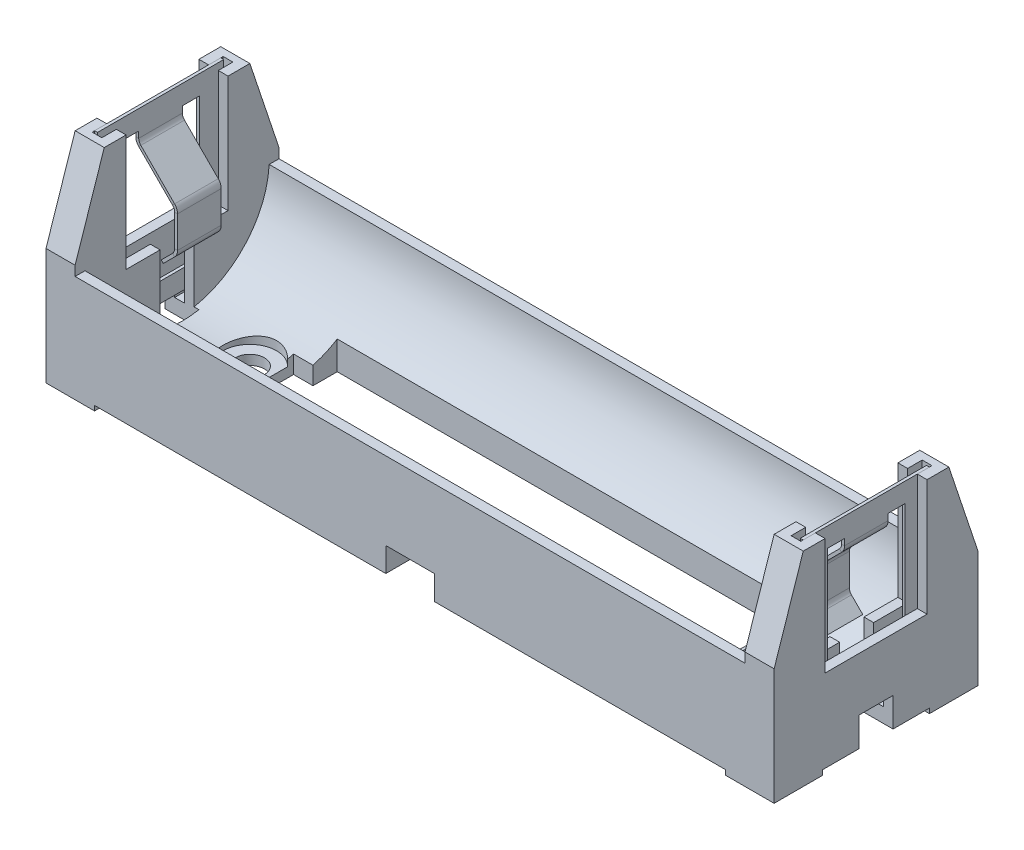
from build123d import *

# Parameters (mm, degrees)
SKETCH1_W              = 75
SKETCH1_H              = 21
BOSS_EXTRUDE1_DEPTH    = 21
CUT_EXTRUDE1_DEPTH     = 0.5
SKETCH5_W              = 2
SKETCH5_H              = 2.5
CUT_EXTRUDE2_DEPTH     = 45.008521902
SKETCH6_W              = 5
SKETCH6_H              = 2.5
CUT_EXTRUDE3_DEPTH     = 2.5
SKETCH8_W              = 34.5
SKETCH8_H              = 10
CUT_EXTRUDE4_DEPTH     = 48.835656157
SKETCH9_W              = 10.5
SKETCH9_H              = 12
CUT_EXTRUDE5_DEPTH     = 79.589121385
CUT_EXTRUDE6_REACH     = 77.731
SKETCH10_R             = 9.5
SKETCH11_W             = 1
SKETCH11_H             = 13.5
CUT_EXTRUDE7_DEPTH     = 19
SKETCH12_W             = 3.5
SKETCH12_H             = 3.5
CUT_EXTRUDE8_DEPTH     = 3
SKETCH13_W             = 1
SKETCH13_H             = 3.5
CUT_EXTRUDE9_DEPTH     = 43.693676347
SKETCH14_R             = 1.5
CUT_EXTRUDE10_DEPTH    = 45.008521902
SKETCH15_R             = 2.75
CUT_EXTRUDE11_DEPTH    = 3
SKETCH16_W             = 13
SKETCH16_H             = 18.5
BASE_FLANGE1_DEPTH     = 0.3
JOG1_START             = -2.25
JOG1_DEPTH             = 4.5
JOG1_2_DEPTH           = 4.5
SKETCHED_START         = -2.25
SKETCHED_BEND1_DEPTH   = 4.5
SKETCHED_BEND1_2_DEPTH = 4.5


# Read off the part's stored shape, not the designer's step: Jog1, Sketched Bend1
# Sheet-metal steps are written as plain solids
with BuildPart() as part:
    # Sketch1 → Boss-Extrude1 (new body)
    with BuildSketch(Plane(origin=(0, 0, 0), x_dir=(1, 0, 0), z_dir=(0, 1, 0))):
        Rectangle(SKETCH1_W, SKETCH1_H)
    extrude(amount=BOSS_EXTRUDE1_DEPTH)

    # Sketch2 → Cut-Extrude1 (cut)
    with BuildSketch(Plane.XZ):
        Polygon((-36, 5.5), (-37.5, 5.5), (-37.5, -5.5), (-36, -5.5), (-36, -9), (-32.5, -9), (-32.5, -10.5), (32.5, -10.5), (32.5, -9), (36, -9), (36, -5.5), (37.5, -5.5), (37.5, 5.5), (36, 5.5), (36, 9), (32.5, 9), (32.5, 10.5), (-32.5, 10.5), (-32.5, 9), (-36, 9), align=None)
    extrude(amount=-CUT_EXTRUDE1_DEPTH, mode=Mode.SUBTRACT)

    # Sketch5 → Cut-Extrude2 (cut, through all)
    with BuildSketch(Plane.XZ.offset(-0.5)):
        Polygon((24, 0), (-23, 0), (-23, -2.5), (-23, -5), (24, -5), align=None)
        Polygon((-23, 2.5), (-23, 0), (24, 0), (24, 5), (-23, 5), align=None)
        with Locations((-24, 1.25)):
            Rectangle(SKETCH5_W, SKETCH5_H)
        with Locations((-24, -1.25)):
            Rectangle(SKETCH5_W, SKETCH5_H)
    extrude(amount=-CUT_EXTRUDE2_DEPTH, mode=Mode.SUBTRACT)

    # Sketch6 → Cut-Extrude3 (cut)
    with BuildSketch(Plane.XZ.offset(-0.5)):
        with Locations((0, -9.25)):
            Rectangle(SKETCH6_W, SKETCH6_H)
        with Locations((0, 9.25)):
            Rectangle(SKETCH6_W, SKETCH6_H)
    extrude(amount=-CUT_EXTRUDE3_DEPTH, mode=Mode.SUBTRACT)

    # Sketch8 → Cut-Extrude4 (cut, through all)
    with BuildSketch(Plane.XY.offset(10.5)):
        with Locations((-17.25, 16)):
            Rectangle(SKETCH8_W, SKETCH8_H)
        with Locations((17.25, 16)):
            Rectangle(SKETCH8_W, SKETCH8_H)
    extrude(amount=-CUT_EXTRUDE4_DEPTH, mode=Mode.SUBTRACT)

    # Sketch9 → Cut-Extrude5 (cut, through all)
    with BuildSketch(Plane(origin=(37.5, 0, 0), x_dir=(0, 0, -1), z_dir=(1, 0, 0))):
        with Locations((0, 15)):
            Rectangle(SKETCH9_W, SKETCH9_H)
        Polygon((-7.5, 21), (-10.5, 12), (-10.5, 21), align=None)
        Polygon((7.5, 21), (10.5, 12), (10.5, 21), align=None)
    extrude(amount=-CUT_EXTRUDE5_DEPTH, mode=Mode.SUBTRACT)

    # Cut-Extrude6: up to this face of the body (flat: up to its plane)
    cut_extrude6_end = Plane(part.part.faces().sort_by_distance((34.5, 15.307692308, 7.3125))[0])
    # Sketch10 → Cut-Extrude6 (cut, up to the picked face)
    with BuildSketch(Plane(origin=(-34.5, 0, 0), x_dir=(0, 0, -1), z_dir=(1, 0, 0)), mode=Mode.PRIVATE) as cut_extrude6_sk1:
        with Locations((0, 11.5)):
            Circle(SKETCH10_R)
    cut_extrude6_tool1 = split(extrude(cut_extrude6_sk1.sketch, amount=CUT_EXTRUDE6_REACH, mode=Mode.PRIVATE), bisect_by=cut_extrude6_end, keep=Keep.BOTH, mode=Mode.PRIVATE)
    add(cut_extrude6_tool1.solids().sort_by(Axis((-34.5, 11.5, 0), (1, 0, 0)))[0], mode=Mode.SUBTRACT)

    # Sketch11 → Cut-Extrude7 (cut)
    with BuildSketch(Plane(origin=(0, 21, 0), x_dir=(1, 0, 0), z_dir=(0, 1, 0))):
        with Locations((-36, 0)):
            Rectangle(SKETCH11_W, SKETCH11_H)
        with Locations((36, 0)):
            Rectangle(SKETCH11_W, SKETCH11_H)
    extrude(amount=-CUT_EXTRUDE7_DEPTH, mode=Mode.SUBTRACT)

    # Sketch12 → Cut-Extrude8 (cut)
    with BuildSketch(Plane.XZ.offset(-0.5)):
        with Locations((35.75, 0)):
            Rectangle(SKETCH12_W, SKETCH12_H)
        with Locations((-35.75, 0)):
            Rectangle(SKETCH12_W, SKETCH12_H)
    extrude(amount=-CUT_EXTRUDE8_DEPTH, mode=Mode.SUBTRACT)

    # Sketch13 → Cut-Extrude9 (cut, through all)
    with BuildSketch(Plane.XZ.offset(-3.5)):
        with Locations((35, 0)):
            Rectangle(SKETCH13_W, SKETCH13_H)
        with Locations((-35, 0)):
            Rectangle(SKETCH13_W, SKETCH13_H)
    extrude(amount=-CUT_EXTRUDE9_DEPTH, mode=Mode.SUBTRACT)

    # Sketch14 → Cut-Extrude10 (cut, through all)
    with BuildSketch(Plane.XZ.offset(-0.5)):
        with Locations(Location((-27, 0, 0), (0, 0, 270))):
            Circle(SKETCH14_R)
        with Locations(Location((27, 0, 0), (0, 0, 270))):
            Circle(SKETCH14_R)
    extrude(amount=-CUT_EXTRUDE10_DEPTH, mode=Mode.SUBTRACT)

    # Sketch15 → Cut-Extrude11 (cut)
    with BuildSketch(Plane(origin=(0, 1.5, 0), x_dir=(-1, 0, 0), z_dir=(0, -1, 0))):
        with Locations((27, 0)):
            Circle(SKETCH15_R)
        with Locations(Location((-27, 0, 0), (0, 0, 90))):
            Circle(SKETCH15_R)
    extrude(amount=-CUT_EXTRUDE11_DEPTH, mode=Mode.SUBTRACT)


with BuildPart() as body_2:
    # Sketch16 → Base-Flange1 (new body)
    with BuildSketch(Plane(origin=(-36.5, 0, 0), x_dir=(0, 0, -1), z_dir=(1, 0, 0))):
        with Locations((0, 11.75)):
            Rectangle(SKETCH16_W, SKETCH16_H)
        Polygon((-4, 19), (-2.25, 19), (-2.25, 8), (2.25, 8), (2.25, 19), (4, 19), (4, 4.5), (-4, 4.5), align=None, mode=Mode.SUBTRACT)
    extrude(amount=BASE_FLANGE1_DEPTH)

    # Jog1 outline → Jog1 (cut)
    with BuildSketch(Plane.XY.offset(JOG1_START)):
        with BuildLine():
            Line((-36.2, 8), (-36.2, 17.618811126))
            ThreePointArc((-36.2, 17.618811126), (-36.422070725, 17.953844803), (-36.5, 18.348167006))
            Line((-36.5, 18.348167006), (-36.5, 8))
            Line((-36.5, 8), (-36.2, 8))
        make_face()
    extrude(amount=JOG1_DEPTH, mode=Mode.SUBTRACT)

    # Jog1 2 outline → Jog1 2 (add)
    with BuildSketch(Plane.XY.offset(JOG1_START)):
        with BuildLine():
            Line((-36.196386889, 17.615180116), (-32.715745145, 14.134538372))
            ThreePointArc((-32.715745145, 14.134538372), (-32.556070336, 13.895568133), (-32.5, 13.613683517))
            Line((-32.5, 13.613683517), (-32.5, 8))
            Line((-32.5, 8), (-32.2, 8))
            Line((-32.2, 8), (-32.2, 13.613683517))
            ThreePointArc((-32.2, 13.613683517), (-32.278906477, 14.010373163), (-32.503613111, 14.346670406))
            Line((-32.503613111, 14.346670406), (-35.984254855, 17.827312151))
            ThreePointArc((-35.984254855, 17.827312151), (-36.143929664, 18.06628239), (-36.2, 18.348167006))
            Line((-36.2, 18.348167006), (-36.2, 17.618811126))
            ThreePointArc((-36.2, 17.618811126), (-36.198195687, 17.616993389), (-36.196386889, 17.615180116))
        make_face()
    extrude(amount=JOG1_2_DEPTH)

    # Sketched Bend1 outline → Sketched Bend1 (cut)
    with BuildSketch(Plane.XY.offset(SKETCHED_START)):
        with BuildLine():
            Line((-32.2, 8), (-32.2, 10.348167006))
            ThreePointArc((-32.2, 10.348167006), (-32.277929275, 9.953844803), (-32.5, 9.618811126))
            Line((-32.5, 9.618811126), (-32.5, 8))
            Line((-32.5, 8), (-32.2, 8))
        make_face()
    extrude(amount=SKETCHED_BEND1_DEPTH, mode=Mode.SUBTRACT)

    # Sketched Bend1 2 outline → Sketched Bend1 2 (add)
    with BuildSketch(Plane.XY.offset(SKETCHED_START)):
        with BuildLine():
            ThreePointArc((-32.503613111, 9.615180116), (-32.501804313, 9.616993389), (-32.5, 9.618811126))
            Line((-32.5, 9.618811126), (-32.5, 10.348167006))
            ThreePointArc((-32.5, 10.348167006), (-32.556070336, 10.06628239), (-32.715745145, 9.827312151))
            Line((-32.715745145, 9.827312151), (-33.883767457, 8.659289839))
            Line((-33.883767457, 8.659289839), (-33.671635422, 8.447157805))
            Line((-33.671635422, 8.447157805), (-32.503613111, 9.615180116))
        make_face()
    extrude(amount=SKETCHED_BEND1_2_DEPTH)


with BuildPart() as body_3:
    # Mirror1: mirrored copy
    add(body_2.part.mirror(Plane(origin=(0, 0, 0), x_dir=(0, 0, 1), z_dir=(1, 0, 0))))


solid = Compound([part.part, body_2.part, body_3.part])
